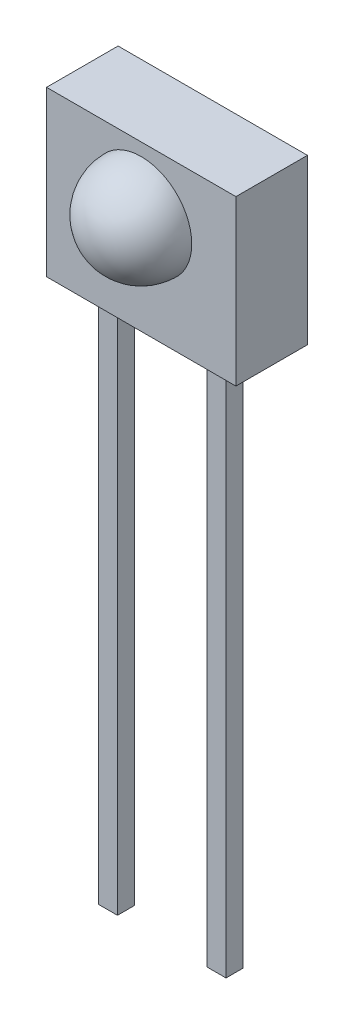
from build123d import *

# Parameters (mm, degrees)
SKETCH1_W           = 4.5
SKETCH1_H           = 3.9
BOSS_EXTRUDE1_DEPTH = 1.7
SKETCH2_R           = 1.2
BOSS_EXTRUDE2_DEPTH = 1.2
FILLET1_R           = 1.2
SKETCH3_W           = 0.45
SKETCH3_H           = 0.4
BOSS_EXTRUDE3_DEPTH = 12.8


with BuildPart() as part:
    # Sketch1 → Boss-Extrude1 (new body)
    with BuildSketch(Plane.XY):
        Rectangle(SKETCH1_W, SKETCH1_H)
    extrude(amount=-BOSS_EXTRUDE1_DEPTH)

    # Sketch2 → Boss-Extrude2 (add)
    with BuildSketch(Plane.XY):
        with Locations(Location((0, 0.45, 0), (0, 0, 180))):
            Circle(SKETCH2_R)
    extrude(amount=BOSS_EXTRUDE2_DEPTH)

    # Fillet1
    fillet1_edges = [part.edges().sort_by_distance(p)[0] for p in [
        (1.2, 0.45, 1.2),
    ]]
    fillet(fillet1_edges, radius=FILLET1_R - 0.0001)  # a hair under: the kernel refuses the full size

    # Sketch3 → Boss-Extrude3 (add)
    with BuildSketch(Plane.XZ.offset(1.95)):
        with Locations((1.29, -0.7)):
            Rectangle(SKETCH3_W, SKETCH3_H)
    boss_extrude3 = extrude(amount=BOSS_EXTRUDE3_DEPTH)

    # Mirror1: Boss-Extrude3 across plane
    add(boss_extrude3.mirror(Plane(origin=(0, 0, 0), x_dir=(0, 0, 1), z_dir=(1, 0, 0))))


solid = part.part
